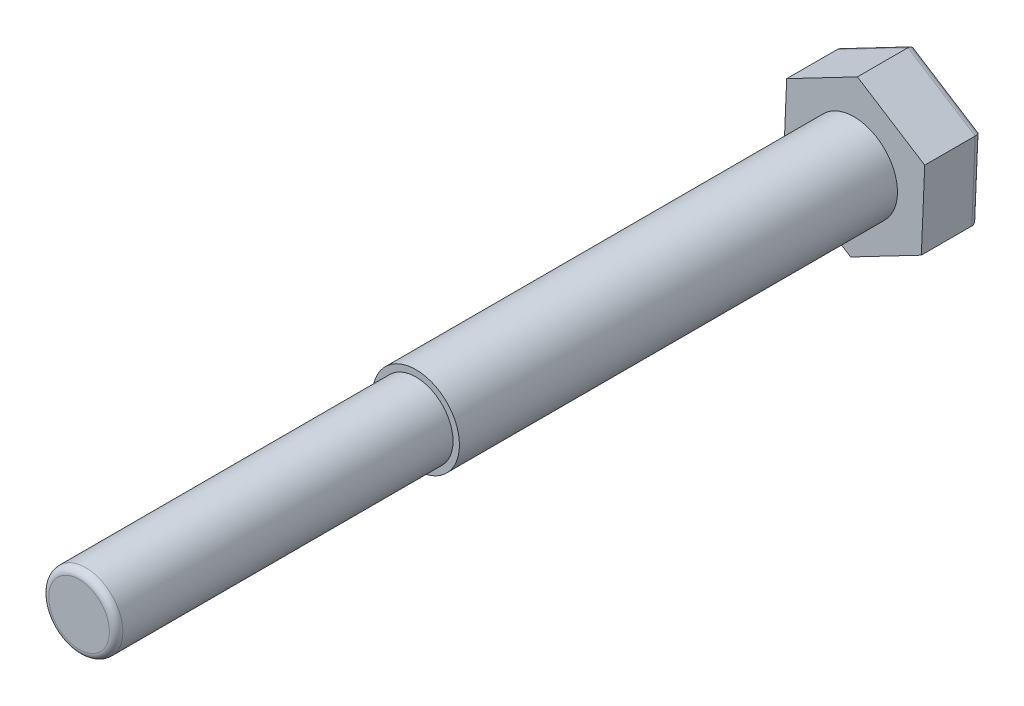
from build123d import *

# Parameters (mm, degrees)
EXTRUDE_307_DEPTH = 17
SKETCH_2_R        = 12.9
EXTRUDE_1_DEPTH   = 130
FILLET_3_R        = 2
SKETCH_3_R        = 11
EXTRUDE_2_DEPTH   = 100
FILLET_4_R        = 2


with BuildPart() as part:
    # 草图1 → Extrude 307 (new body)
    with BuildSketch(Plane.XY):
        Polygon((20.984201837, 10.954296262), (1.005402075, 23.65), (-19.978799762, 12.695703738), (-20.984201837, -10.954296262), (-1.005402075, -23.65), (19.978799762, -12.695703738), align=None)
    extrude(amount=EXTRUDE_307_DEPTH)

    # 草图2 → 凸台-拉伸1 (add)
    with BuildSketch(Plane.XY.offset(17)):
        Circle(SKETCH_2_R)
    extrude(amount=EXTRUDE_1_DEPTH)

    # 圆角3
    fillet_3_edges = [part.edges().sort_by_distance(p)[0] for p in [
        (10.994801956, 17.302148131, 0),
        (-9.486698843, 18.172851869, 0),
        (-20.4815008, 0.870703738, 0),
        (-10.994801956, -17.302148131, 0),
        (9.486698843, -18.172851869, 0),
        (20.4815008, -0.870703738, 0),
    ]]
    fillet(fillet_3_edges, radius=FILLET_3_R)

    # 草图3 → 凸台-拉伸2 (add)
    with BuildSketch(Plane.XY.offset(147)):
        Circle(SKETCH_3_R)
    extrude(amount=EXTRUDE_2_DEPTH)

    # 圆角4
    fillet_4_edges = [part.edges().sort_by_distance(p)[0] for p in [
        (-11, 0, 247),
    ]]
    fillet(fillet_4_edges, radius=FILLET_4_R)


solid = part.part
